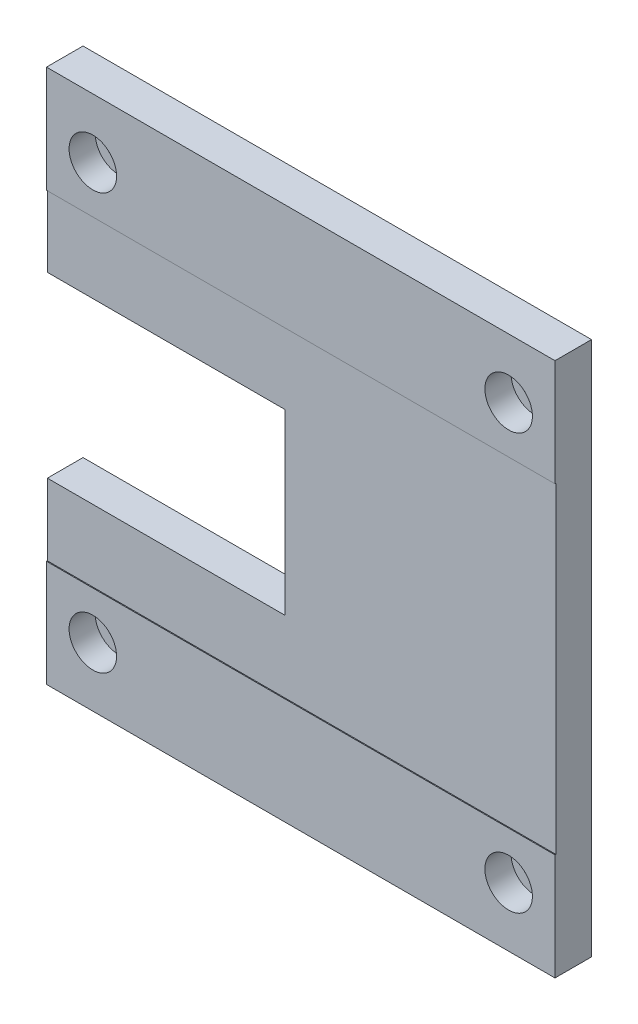
from build123d import *

# Parameters (mm, degrees)
SKETCH_1_W                   = 85.6
SKETCH_1_H                   = 90
EXTRUDE_1_DEPTH              = 6
SKETCH_2_W                   = 85.6
SKETCH_2_H                   = 17.95
EXTRUDE_2_DEPTH              = 0.15
SKETCH_3_W                   = 40
SKETCH_3_H                   = 30
CUT_EXTRUDE_1_DEPTH          = 125.351759135
HOLE_WIZARD_M4_1_D           = 4.5
HOLE_WIZARD_M4_1_CBORE_D     = 8
HOLE_WIZARD_M4_1_CBORE_DEPTH = 4.4


with BuildPart() as part:
    # 草图1 → 凸台-拉伸1 (new body)
    with BuildSketch(Plane.XY):
        with Locations((42.8, 45)):
            Rectangle(SKETCH_1_W, SKETCH_1_H)
    extrude(amount=EXTRUDE_1_DEPTH)

    # 草图2 → 凸台-拉伸2 (add)
    with BuildSketch(Plane.XY.offset(6)):
        with Locations((42.8, 81.025)):
            Rectangle(SKETCH_2_W, SKETCH_2_H)
        with Locations((42.8, 8.975)):
            Rectangle(SKETCH_2_W, SKETCH_2_H)
    extrude(amount=EXTRUDE_2_DEPTH)

    # 草图3 → 切除-拉伸1 (cut, through all)
    with BuildSketch(Plane.XY.offset(6)):
        with Locations((20, 45)):
            Rectangle(SKETCH_3_W, SKETCH_3_H)
    extrude(amount=-CUT_EXTRUDE_1_DEPTH, mode=Mode.SUBTRACT)

    # M4 六角凹头螺钉的柱形沉头孔1 (through all)
    with Locations(Plane.XY.offset(6.15)):
        with Locations((77.8, 80), (7.8, 80), (7.8, 10), (77.8, 10)):
            CounterBoreHole(HOLE_WIZARD_M4_1_D / 2, HOLE_WIZARD_M4_1_CBORE_D / 2, HOLE_WIZARD_M4_1_CBORE_DEPTH)


solid = part.part
